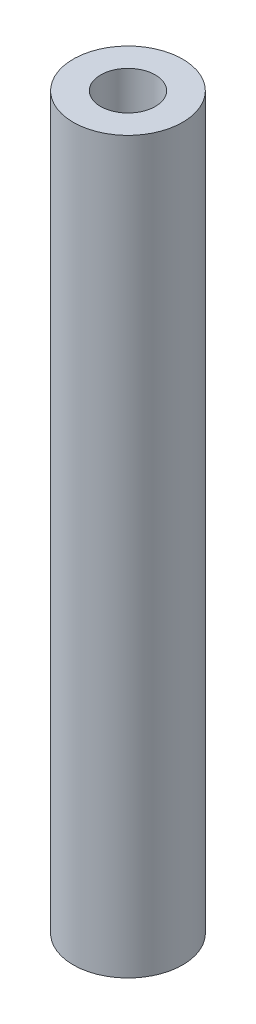
from build123d import *

# Parameters (mm, degrees)
SKETCH2_R           = 3
SKETCH2_R_2         = 1.5
BOSS_EXTRUDE1_DEPTH = 40


with BuildPart() as part:
    # Sketch2 → Boss-Extrude1 (new body)
    with BuildSketch(Plane(origin=(0, 0, 0), x_dir=(1, 0, 0), z_dir=(0, 1, 0))):
        with Locations((-15.084082691, 6.46581124)):
            Circle(SKETCH2_R)
        with Locations((-15.084082691, 6.46581124)):
            Circle(SKETCH2_R_2, mode=Mode.SUBTRACT)
    extrude(amount=BOSS_EXTRUDE1_DEPTH)


solid = part.part
